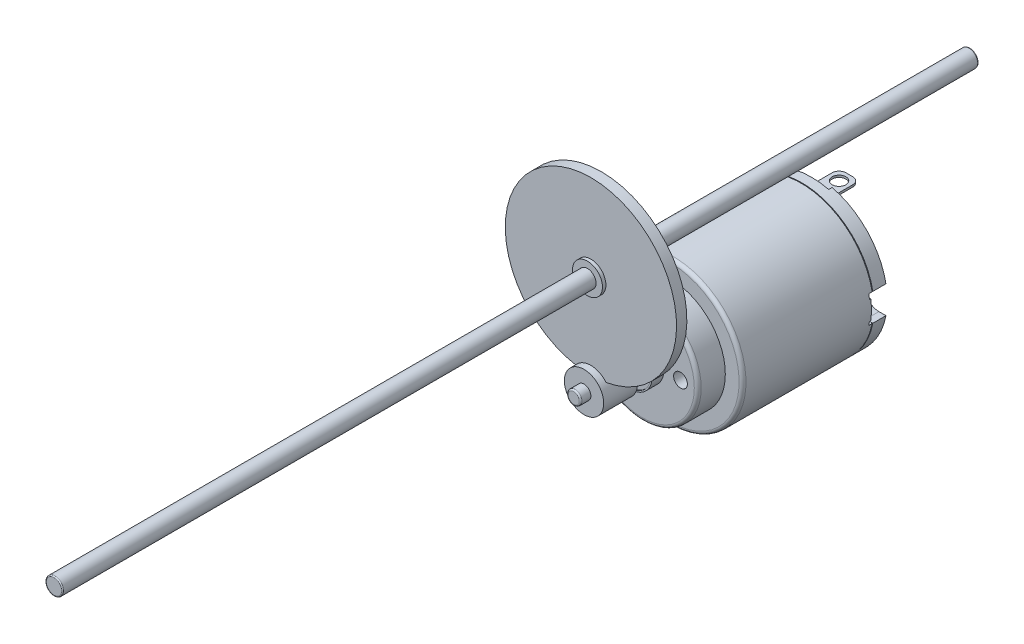
from build123d import *
from build123d.topology import SkipClean

# Parameters (mm, degrees)
ESBO_O1_R                      = 1
RESSALTO_EXTRUS_O1_DEPTH       = 38
ESBO_O2_R                      = 8
RESSALTO_EXTRUS_O2_DEPTH       = 25
ESBO_O3_R                      = 3.075
RESSALTO_EXTRUS_O3_DEPTH       = 1.7
ESBO_O4_R                      = 10.5
RESSALTO_EXTRUS_O4_DEPTH       = 21
ESBO_O5_R                      = 3.125
RESSALTO_EXTRUS_O5_DEPTH       = 2
ESBO_O6_W                      = 3
ESBO_O6_H                      = 0.3
RESSALTO_EXTRUS_O6_DEPTH       = 5
ESBO_O7_R                      = 1
CORTE_EXTRUS_O1_DEPTH          = 4
ESBO_O8_R                      = 1
CORTE_EXTRUS_O2_DEPTH          = 4
FILETE1_R                      = 1
FILETE2_R                      = 0.2
CORTE_EXTRUS_O3_DEPTH          = 15
CORTE_EXTRUS_O3_DEPTH_BACK     = 38
ESBO_O9_R                      = 1
ESBO_O10_W                     = 1.239132447
ESBO_O10_H                     = 9.327126009
CORTE_EXTRUS_O4_DEPTH          = 2
CORTE_EXTRUS_O5_DEPTH          = 0.5
CORTE_EXTRUS_O6_DEPTH          = 2
ESBO_O13_W                     = 3
ESBO_O13_H                     = 0.3
RESSALTO_EXTRUS_O7_DEPTH       = 6
ESBO_O14_R                     = 11.30933102
ESBO_O14_R_2                   = 10.3
CORTE_EXTRUS_O7_DEPTH          = 0.1
FILETE3_R                      = 0.5
ESBO_O15_R                     = 2.875
CORTE_EXTRUS_O8_DEPTH          = 0.1
CORTE_EXTRUS_O9_DEPTH          = 2.5
RESSALTO_EXTRUS_O8_DEPTH       = 0.2
ESBO_O18_R                     = 2.85
RESSALTO_EXTRUS_O9_DEPTH       = 4.9
ESBO_O19_R                     = 12.425
RESSALTO_EXTRUS_O10_DEPTH      = 1.5
ESBO_O20_R                     = 2.175
RESSALTO_EXTRUS_O11_DEPTH      = 2
ESBO_O21_R                     = 2.175
RESSALTO_EXTRUS_O12_DEPTH      = 3.9
CORTE_EXTRUS_O10_DEPTH         = 12
CORTE_EXTRUS_O10_DEPTH_BACK    = 7.9
ESBO_O22_R                     = 1.25
RESSALTO_EXTRUS_O13_DEPTH      = 129.9
RESSALTO_EXTRUS_O13_DEPTH_BACK = 3
ESBO_O23_R                     = 1.25
FILETE4_R                      = 0.15


with BuildPart() as part:
    # Esboço1 → Ressalto-extrusão1 (new body)
    with BuildSketch(Plane.XY):
        Circle(ESBO_O1_R)
    extrude(amount=RESSALTO_EXTRUS_O1_DEPTH)

    # Esboço2 → Ressalto-extrusão2 (add)
    with BuildSketch(Plane.XY.offset(28)):
        Circle(ESBO_O2_R)
    extrude(amount=-RESSALTO_EXTRUS_O2_DEPTH)

    # Esboço3 → Ressalto-extrusão3 (add)
    with BuildSketch(Plane.XY.offset(28)):
        Circle(ESBO_O3_R)
    extrude(amount=RESSALTO_EXTRUS_O3_DEPTH)

    # Esboço4 → Ressalto-extrusão4 (add)
    with BuildSketch(Plane(origin=(0, 0, 3), x_dir=(-1, 0, 0), z_dir=(0, 0, -1))):
        Circle(ESBO_O4_R)
    extrude(amount=-RESSALTO_EXTRUS_O4_DEPTH)

    # Esboço5 → Ressalto-extrusão5 (add)
    with BuildSketch(Plane(origin=(0, 0, 3), x_dir=(-1, 0, 0), z_dir=(0, 0, -1))):
        Circle(ESBO_O5_R)
    extrude(amount=RESSALTO_EXTRUS_O5_DEPTH)

    # Esboço6 → Ressalto-extrusão6 (add)
    with BuildSketch(Plane(origin=(0, 0, 3), x_dir=(-1, 0, 0), z_dir=(0, 0, -1))):
        with Locations((0, 7.9)):
            Rectangle(ESBO_O6_W, ESBO_O6_H)
        with Locations((0, -7.9)):
            Rectangle(ESBO_O6_W, ESBO_O6_H)
    extrude(amount=RESSALTO_EXTRUS_O6_DEPTH)

    # Esboço7 → Corte-extrusão1 (cut)
    with BuildSketch(Plane(origin=(0, 8.05, 0), x_dir=(1, 0, 0), z_dir=(0, 1, 0))):
        with Locations((0, 0.5)):
            Circle(ESBO_O7_R)
    extrude(amount=-CORTE_EXTRUS_O1_DEPTH, mode=Mode.SUBTRACT)

    # Esboço8 → Corte-extrusão2 (cut)
    with BuildSketch(Plane(origin=(0, -7.75, 0), x_dir=(1, 0, 0), z_dir=(0, 1, 0))):
        with Locations((0, 0.5)):
            Circle(ESBO_O8_R)
    extrude(amount=-CORTE_EXTRUS_O2_DEPTH, mode=Mode.SUBTRACT)

    # Filete1
    filete1_edges = [part.edges().sort_by_distance(p)[0] for p in [
        (1.5, -7.9, -2),
        (-1.5, -7.9, -2),
        (1.5, 7.9, -2),
        (-1.5, 7.9, -2),
    ]]
    fillet(filete1_edges, radius=FILETE1_R)

    # Filete2
    filete2_edges = [part.edges().sort_by_distance(p)[0] for p in [
        (-1, 0, 0),
        (-1, 0, 38),
    ]]
    fillet(filete2_edges, radius=FILETE2_R)

    # Esboço9 → Corte-extrusão3 (cut, two sides: drawn at the far end of the back side and taken through both)
    with BuildSketch(Plane(origin=(0, 0, 3), x_dir=(-1, 0, 0), z_dir=(0, 0, -1)).offset(-CORTE_EXTRUS_O3_DEPTH_BACK)):
        with Locations((-5.5, 0)):
            Circle(ESBO_O9_R)
        with Locations((5.5, 0)):
            Circle(ESBO_O9_R)
    extrude(amount=CORTE_EXTRUS_O3_DEPTH + CORTE_EXTRUS_O3_DEPTH_BACK, mode=Mode.SUBTRACT)

    # Esboço10 → Corte-extrusão4 (cut)
    with BuildSketch(Plane(origin=(0, 0, 1), x_dir=(-1, 0, 0), z_dir=(0, 0, -1))):
        with Locations((3.194566224, -0.245450684)):
            Rectangle(ESBO_O10_W, ESBO_O10_H)
    extrude(amount=-CORTE_EXTRUS_O4_DEPTH, mode=Mode.SUBTRACT)

    # Esboço11 → Corte-extrusão5 (cut)
    with BuildSketch(Plane(origin=(0, 0, 3), x_dir=(-1, 0, 0), z_dir=(0, 0, -1))):
        with BuildLine():
            Line((-3.708099244, 1.5), (-7.348469228, 1.5))
            ThreePointArc((-7.348469228, 1.5), (-5.657498182, 4.923689097), (-2.5, 7.071067812))
            Line((-2.5, 7.071067812), (-2.5, 12.5))
            Line((-2.5, 12.5), (2.5, 12.5))
            Line((2.5, 12.5), (2.5, 7.071067812))
            ThreePointArc((2.5, 7.071067812), (5.657498182, 4.923689097), (7.348469228, 1.5))
            Line((7.348469228, 1.5), (3.708099244, 1.5))
            ThreePointArc((3.708099244, 1.5), (3.208309493, 2.388880532), (2.5, 3.122498999))
            ThreePointArc((2.5, 3.122498999), (-1.011435463, 3.870012701), (-3.708099244, 1.5))
        make_face()
        with BuildLine():
            Line((7.348469228, -1.5), (3.708099244, -1.5))
            ThreePointArc((3.708099244, -1.5), (1.011435463, -3.870012701), (-2.5, -3.122498999))
            ThreePointArc((-2.5, -3.122498999), (-3.208309493, -2.388880532), (-3.708099244, -1.5))
            Line((-3.708099244, -1.5), (-7.348469228, -1.5))
            ThreePointArc((-7.348469228, -1.5), (-5.657498182, -4.923689097), (-2.5, -7.071067812))
            Line((-2.5, -7.071067812), (-2.5, -12.5))
            Line((-2.5, -12.5), (2.5, -12.5))
            Line((2.5, -12.5), (2.5, -7.071067812))
            ThreePointArc((2.5, -7.071067812), (5.657498182, -4.923689097), (7.348469228, -1.5))
        make_face()
    extrude(amount=-CORTE_EXTRUS_O5_DEPTH, mode=Mode.SUBTRACT)


with BuildPart() as corte_extrus_o5_piece_1:
    # of the separate pieces the step leaves, piece 1, a body of its own (corte_extrus_o5_pieces)
    add(part.part.solids().sort_by_distance((1, 0, 0.2))[0])

    # Esboço12 → Corte-extrusão6 (cut)
    with BuildSketch(Plane(origin=(0, 0, 3.5), x_dir=(-1, 0, 0), z_dir=(0, 0, -1))):
        with BuildLine():
            ThreePointArc((3.375, -5.845671476), (4.772970773, -4.772970773), (5.845671476, -3.375))
            ThreePointArc((5.845671476, -3.375), (5.479646072, -2.008974596), (4.113620668, -2.375))
            ThreePointArc((4.113620668, -2.375), (3.358757211, -3.358757211), (2.375, -4.113620668))
            ThreePointArc((2.375, -4.113620668), (2.008974596, -5.479646072), (3.375, -5.845671476))
        make_face()
        with BuildLine():
            ThreePointArc((-3.375, 5.845671476), (-4.772970773, 4.772970773), (-5.845671476, 3.375))
            ThreePointArc((-5.845671476, 3.375), (-5.479646072, 2.008974596), (-4.113620668, 2.375))
            ThreePointArc((-4.113620668, 2.375), (-3.358757211, 3.358757211), (-2.375, 4.113620668))
            ThreePointArc((-2.375, 4.113620668), (-2.008974596, 5.479646072), (-3.375, 5.845671476))
        make_face()
    extrude(amount=-CORTE_EXTRUS_O6_DEPTH, mode=Mode.SUBTRACT)



with BuildPart() as corte_extrus_o5_piece_2:
    # of the separate pieces the step leaves, piece 2, a body of its own (corte_extrus_o5_pieces)
    add(part.part.solids().sort_by_distance((1.5, 8.05, -1))[0])


with BuildPart() as corte_extrus_o5_piece_3:
    # of the separate pieces the step leaves, piece 3, a body of its own (corte_extrus_o5_pieces)
    add(part.part.solids().sort_by_distance((-1.5, -8.05, -1))[0])


with BuildPart() as corte_extrus_o5_piece_1_1:
    add(corte_extrus_o5_piece_1.part)

    add(corte_extrus_o5_piece_2.part)  # Ressalto-extrusão7 merges Corte-extrusão5 piece 2

    add(corte_extrus_o5_piece_3.part)  # Ressalto-extrusão7 merges Corte-extrusão5 piece 3
    # Esboço13 → Ressalto-extrusão7 (add)
    with BuildSketch(Plane.XY.offset(3)):
        with Locations((0, 7.9)):
            Rectangle(ESBO_O13_W, ESBO_O13_H)
        with Locations((0, -7.9)):
            Rectangle(ESBO_O13_W, ESBO_O13_H)
    extrude(amount=RESSALTO_EXTRUS_O7_DEPTH)

    # Esboço14 → Corte-extrusão7 (cut)
    with BuildSketch(Plane(origin=(0, 0, 5), x_dir=(-1, 0, 0), z_dir=(0, 0, -1))):
        Circle(ESBO_O14_R)
        Circle(ESBO_O14_R_2, mode=Mode.SUBTRACT)
    extrude(amount=CORTE_EXTRUS_O7_DEPTH, mode=Mode.SUBTRACT)

    # Filete3
    filete3_edges = [corte_extrus_o5_piece_1_1.edges().sort_by_distance(p)[0] for p in [
        (-8, 0, 28),
        (10.5, 0, 24),
    ]]
    fillet(filete3_edges, radius=FILETE3_R)

    # Esboço15 → Corte-extrusão8 (cut)
    with BuildSketch(Plane.XY.offset(29.7)):
        Circle(ESBO_O15_R)
    extrude(amount=-CORTE_EXTRUS_O8_DEPTH, mode=Mode.SUBTRACT)


with BuildPart() as corte_extrus_o8_piece_1:
    # of the separate pieces the step leaves, piece 1, a body of its own (corte_extrus_o8_pieces)
    add(corte_extrus_o5_piece_1_1.part.solids().sort_by_distance((7.5, 0, 28))[0])

    # Esboço16 → Corte-extrusão9 (cut)
    with BuildSketch(Plane(origin=(0, 0, 3), x_dir=(-1, 0, 0), z_dir=(0, 0, -1))):
        with BuildLine():
            Line((-9.287087811, 2), (-10.307764064, 2))
            ThreePointArc((-10.307764064, 2), (-10.5, 0), (-10.307764064, -2))
            Line((-10.307764064, -2), (-9.287087811, -2))
            ThreePointArc((-9.287087811, -2), (-7.287087811, 0), (-9.287087811, 2))
        make_face()
        with BuildLine():
            Line((10.307764064, 2), (9.287087811, 2))
            ThreePointArc((9.287087811, 2), (7.287087811, 0), (9.287087811, -2))
            Line((9.287087811, -2), (10.307764064, -2))
            ThreePointArc((10.307764064, -2), (10.5, 0), (10.307764064, 2))
        make_face()
    extrude(amount=-CORTE_EXTRUS_O9_DEPTH, mode=Mode.SUBTRACT)

    # Esboço17 → Ressalto-extrusão8 (add)
    with SkipClean():  # the faces are left unmerged after this step: merging them gives an invalid solid
        with BuildSketch(Plane(origin=(0, 0, 5.5), x_dir=(-1, 0, 0), z_dir=(0, 0, -1))):
            with BuildLine():
                Line((-8.395134617, 1.117244286), (-8.597314976, 1.317232401))
                Line((-8.597314976, 1.317232401), (-10.417048469, 1.317232401))
                ThreePointArc((-10.417048469, 1.317232401), (-10.499595037, -0.092217463), (-10.392304845, -1.5))
                Line((-10.392304845, -1.5), (-8.566600265, -1.5))
                Line((-8.566600265, -1.5), (-8.368780624, -1.300011885))
                Line((-8.368780624, -1.300011885), (-8.395134617, 1.117244286))
            make_face()
            with BuildLine():
                ThreePointArc((10.392304845, -1.5), (10.499595037, -0.092217463), (10.417048469, 1.317232401))
                Line((10.417048469, 1.317232401), (8.597314976, 1.317232401))
                Line((8.597314976, 1.317232401), (8.395134617, 1.117244286))
                Line((8.395134617, 1.117244286), (8.368780624, -1.300011885))
                Line((8.368780624, -1.300011885), (8.566600265, -1.5))
                Line((8.566600265, -1.5), (10.392304845, -1.5))
            make_face()
        extrude(amount=RESSALTO_EXTRUS_O8_DEPTH)


with BuildPart() as corte_extrus_o8_piece_2:
    # of the separate pieces the step leaves, piece 2, a body of its own (corte_extrus_o8_pieces)
    add(corte_extrus_o5_piece_1_1.part.solids().sort_by_distance((1, 0, 37.8))[0])

    # Esboço18 → Ressalto-extrusão9 (add)
    with BuildSketch(Plane.XY.offset(36.5)):
        Circle(ESBO_O18_R)
    extrude(amount=-RESSALTO_EXTRUS_O9_DEPTH)

    # Esboço19 → Ressalto-extrusão10 (add)
    with BuildSketch(Plane.XY.offset(35.5)):
        with Locations((0, 14.025)):
            Circle(ESBO_O19_R)
    extrude(amount=-RESSALTO_EXTRUS_O10_DEPTH)

    # Esboço20 → Ressalto-extrusão11 (add)
    with BuildSketch(Plane(origin=(0, 0, 34), x_dir=(-1, 0, 0), z_dir=(0, 0, -1))):
        with Locations((0, 14.025)):
            Circle(ESBO_O20_R)
    extrude(amount=-RESSALTO_EXTRUS_O11_DEPTH)

    # Esboço21 → Ressalto-extrusão12 (add)
    with BuildSketch(Plane.XY.offset(36)):
        with Locations((0, 14.025)):
            Circle(ESBO_O21_R)
    extrude(amount=-RESSALTO_EXTRUS_O12_DEPTH)

    # Esboço22 → Corte-extrusão10 (cut, two sides: drawn at the far end of the back side and taken through both)
    with BuildSketch(Plane(origin=(0, 0, 32.1), x_dir=(-1, 0, 0), z_dir=(0, 0, -1)).offset(-CORTE_EXTRUS_O10_DEPTH_BACK)):
        with Locations((0, 14.025)):
            Circle(ESBO_O22_R)
    extrude(amount=CORTE_EXTRUS_O10_DEPTH + CORTE_EXTRUS_O10_DEPTH_BACK, mode=Mode.SUBTRACT)

    # Esboço23 → Ressalto-extrusão13 (add, two sides: drawn at the far end of the back side and taken through both)
    with BuildSketch(Plane.XY.offset(-16.5).offset(-RESSALTO_EXTRUS_O13_DEPTH_BACK)):
        with Locations((0, 14.025)):
            Circle(ESBO_O23_R)
    extrude(amount=RESSALTO_EXTRUS_O13_DEPTH + RESSALTO_EXTRUS_O13_DEPTH_BACK)

    # Filete4
    filete4_edges = [corte_extrus_o8_piece_2.edges().sort_by_distance(p)[0] for p in [
        (-1.25, 14.025, -19.5),
        (-1.25, 14.025, 113.4),
    ]]
    fillet(filete4_edges, radius=FILETE4_R)


solid = Compound([corte_extrus_o8_piece_1.part, corte_extrus_o8_piece_2.part])
